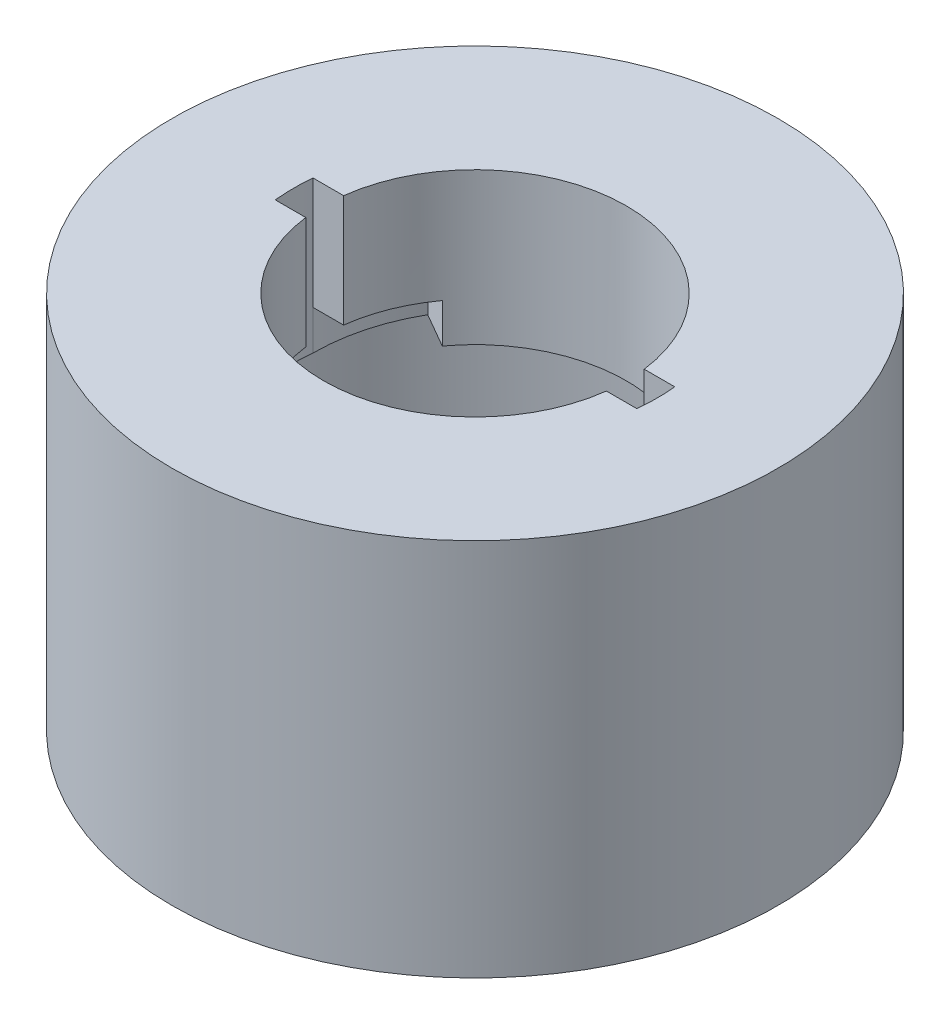
from build123d import *

# Parameters (mm, degrees)
SKETCH1_R                    = 40
BOSS_EXTRUDE1_DEPTH          = 50
CUT_EXTRUDE1_DEPTH           = 20
SKETCH2_W                    = 5.5
SKETCH2_H                    = 5.2
CUT_REVOLVE1_ANGLE           = 30
CUT_REVOLVE1_OTHER_WAY_ANGLE = 30
SHELL1_START                 = -46
SHELL1_OUTLINE_R             = 36
SHELL1_DEPTH                 = 26
SHELL1_START_2               = -20
SHELL1_2_OUTLINE_R           = 36
SHELL1_2_DEPTH               = 16
SHELL1_START_3               = -10.8
SHELL1_3_DEPTH               = 6.8


# Read off the part's stored shape, not the designer's step: Shell1
with BuildPart() as part:
    # Sketch1 → Boss-Extrude1 (new body)
    with BuildSketch(Plane(origin=(0, 0, 0), x_dir=(1, 0, 0), z_dir=(0, 1, 0))):
        with Locations(Location((0, 0, 0), (0, 0, 270))):
            Circle(SKETCH1_R)
    extrude(amount=-BOSS_EXTRUDE1_DEPTH)

    # Sketch1<3> → Cut-Extrude1 (cut)
    with BuildSketch(Plane(origin=(0, 0, 0), x_dir=(1, 0, 0), z_dir=(0, 1, 0))):
        with BuildLine():
            Line((19.843134833, 2.5), (23.869436525, 2.5))
            ThreePointArc((23.869436525, 2.5), (24, 0), (23.869436525, -2.5))
            Line((23.869436525, -2.5), (19.843134833, -2.5))
            ThreePointArc((19.843134833, -2.5), (0, -20), (-19.843134833, -2.5))
            Line((-19.843134833, -2.5), (-23.869436525, -2.5))
            ThreePointArc((-23.869436525, -2.5), (-24, 0), (-23.869436525, 2.5))
            Line((-23.869436525, 2.5), (-19.843134833, 2.5))
            ThreePointArc((-19.843134833, 2.5), (0, 20), (19.843134833, 2.5))
        make_face()
    extrude(amount=-CUT_EXTRUDE1_DEPTH, mode=Mode.SUBTRACT)

    # Sketch2 → Cut-Revolve1 (revolve, cut)
    with BuildSketch(Plane.XY.offset(-2.5)):
        with Locations((-21.119436525, -17.4)):
            Rectangle(SKETCH2_W, SKETCH2_H)
        with Locations((21.119436525, -17.4)):
            Rectangle(SKETCH2_W, SKETCH2_H)
    revolve(axis=Axis((0, -29.434320881, -2.5), (0, 1, 0)), revolution_arc=CUT_REVOLVE1_ANGLE, mode=Mode.SUBTRACT)

    # Sketch2 → Cut-Revolve1 other way (revolve, cut)
    with BuildSketch(Plane.XY.offset(-2.5)):
        with Locations((-21.119436525, -17.4)):
            Rectangle(SKETCH2_W, SKETCH2_H)
        with Locations((21.119436525, -17.4)):
            Rectangle(SKETCH2_W, SKETCH2_H)
    revolve(axis=Axis((0, -29.434320881, -2.5), (0, -1, 0)), revolution_arc=CUT_REVOLVE1_OTHER_WAY_ANGLE, mode=Mode.SUBTRACT)

    # Shell1 outline → Shell1 (cut)
    with BuildSketch(Plane(origin=(0, 0, 0), x_dir=(1, 0, 0), z_dir=(0, 1, 0)).offset(SHELL1_START)):
        Circle(SHELL1_OUTLINE_R)
    extrude(amount=SHELL1_DEPTH, mode=Mode.SUBTRACT)

    # Shell1 2 outline → Shell1 2 (cut)
    with BuildSketch(Plane(origin=(0, 0, 0), x_dir=(1, 0, 0), z_dir=(0, 1, 0)).offset(SHELL1_START_2)):
        Circle(SHELL1_2_OUTLINE_R)
        with BuildLine():
            Line((-26.376229681, -6.5), (-27.235087663, -6.5))
            ThreePointArc((-27.235087663, -6.5), (-27.933967525, -1.921837216), (-27.86865358, 2.708901561))
            ThreePointArc((-27.86865358, 2.708901561), (-26.29664821, 11.729939607), (-21.885751383, 19.754546606))
            Line((-21.885751383, 19.754546606), (-17.004628173, 16.936428806))
            ThreePointArc((-17.004628173, 16.936428806), (0, 24), (17.004628173, 16.936428806))
            Line((17.004628173, 16.936428806), (21.885751383, 19.754546606))
            ThreePointArc((21.885751383, 19.754546606), (26.29664821, 11.729939607), (27.86865358, 2.708901561))
            ThreePointArc((27.86865358, 2.708901561), (27.933967525, -1.921837216), (27.235087663, -6.5))
            Line((27.235087663, -6.5), (26.376229681, -6.5))
            ThreePointArc((26.376229681, -6.5), (24.481402921, -10.817897852), (21.885751383, -14.754546606))
            Line((21.885751383, -14.754546606), (19.806304482, -13.553977378))
            ThreePointArc((19.806304482, -13.553977378), (0, -24), (-19.806304482, -13.553977378))
            Line((-19.806304482, -13.553977378), (-21.885751383, -14.754546606))
            ThreePointArc((-21.885751383, -14.754546606), (-24.481402921, -10.817897852), (-26.376229681, -6.5))
        make_face(mode=Mode.SUBTRACT)
    extrude(amount=SHELL1_2_DEPTH, mode=Mode.SUBTRACT)

    # Shell1 3 outline → Shell1 3 (cut)
    with BuildSketch(Plane(origin=(0, 0, 0), x_dir=(1, 0, 0), z_dir=(0, 1, 0)).offset(SHELL1_START_3)):
        with BuildLine():
            Line((-23.103030104, -6.5), (-26.376229681, -6.5))
            ThreePointArc((-26.376229681, -6.5), (-24.481402921, -10.817897852), (-21.885751383, -14.754546606))
            Line((-21.885751383, -14.754546606), (-19.806304482, -13.553977378))
            ThreePointArc((-19.806304482, -13.553977378), (-21.742640085, -10.161574786), (-23.103030104, -6.5))
        make_face()
        with BuildLine():
            ThreePointArc((-21.885751383, 19.754546606), (-26.29664821, 11.729939607), (-27.86865358, 2.708901561))
            ThreePointArc((-27.86865358, 2.708901561), (-27.616999866, 4.615335138), (-27.235087663, 6.5))
            Line((-27.235087663, 6.5), (-23.103030104, 6.5))
            ThreePointArc((-23.103030104, 6.5), (-20.721626979, 12.108434057), (-17.004628173, 16.936428806))
            Line((-17.004628173, 16.936428806), (-21.885751383, 19.754546606))
        make_face()
        with BuildLine():
            ThreePointArc((23.103030104, -6.5), (21.742640085, -10.161574786), (19.806304482, -13.553977378))
            Line((19.806304482, -13.553977378), (21.885751383, -14.754546606))
            ThreePointArc((21.885751383, -14.754546606), (24.481402921, -10.817897852), (26.376229681, -6.5))
            Line((26.376229681, -6.5), (23.103030104, -6.5))
        make_face()
        with BuildLine():
            Line((21.885751383, 19.754546606), (17.004628173, 16.936428806))
            ThreePointArc((17.004628173, 16.936428806), (20.721626979, 12.108434057), (23.103030104, 6.5))
            Line((23.103030104, 6.5), (27.235087663, 6.5))
            ThreePointArc((27.235087663, 6.5), (27.616999866, 4.615335138), (27.86865358, 2.708901561))
            ThreePointArc((27.86865358, 2.708901561), (26.29664821, 11.729939607), (21.885751383, 19.754546606))
        make_face()
    extrude(amount=SHELL1_3_DEPTH, mode=Mode.SUBTRACT)


solid = part.part
